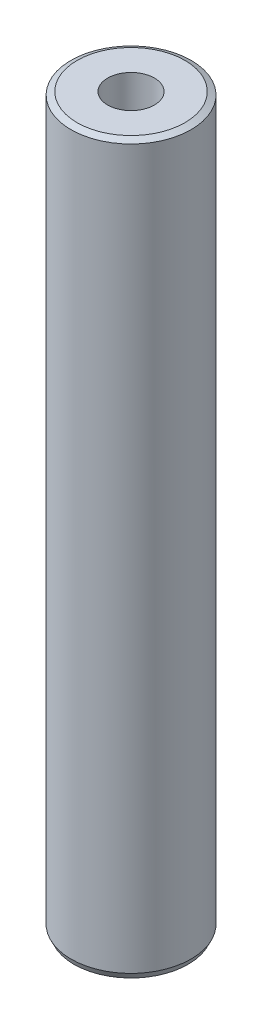
from build123d import *
from OCP.BRepFilletAPI import BRepFilletAPI_MakeChamfer

# Parameters (mm, degrees)
SKETCH1_R           = 10
BOSS_EXTRUDE1_DEPTH = 121.087244038
SKETCH2_R           = 3.893390848
CUT_EXTRUDE1_DEPTH  = 122.910297632
CHAMFER1_SIZE       = 0.498429606
CHAMFER1_SIZE2      = 1.020423305


with BuildPart() as part:
    # Sketch1 → Boss-Extrude1 (new body)
    with BuildSketch(Plane(origin=(0, 0, 0), x_dir=(1, 0, 0), z_dir=(0, 1, 0))):
        Circle(SKETCH1_R)
    extrude(amount=BOSS_EXTRUDE1_DEPTH)

    # Sketch2 → Cut-Extrude1 (cut, through all)
    with BuildSketch(Plane(origin=(0, 0, 0), x_dir=(1, 0, 0), z_dir=(0, 1, 0))):
        Circle(SKETCH2_R)
    extrude(amount=CUT_EXTRUDE1_DEPTH, mode=Mode.SUBTRACT)

    # Chamfer1: one chamfer whose edges measure the first distance from different faces: ONE call of the kernel's chamfer builder (chamfer() names one face for all edges)
    chamfer1_edges_1 = [part.edges().sort_by_distance(p)[0] for p in [
        (-10, 121.087244038, 0),
    ]]
    chamfer1_side_1 = [part.faces().sort_by_distance(p)[0] for p in [
        (-10, 60.543622019, 0),
    ]]
    chamfer1_edges_2 = [part.edges().sort_by_distance(p)[0] for p in [
        (-10, 0, 0),
    ]]
    chamfer1_side_2 = [part.faces().sort_by_distance(p)[0] for p in [
        (-9.717157288, 0, 0),
    ]]
    chamfer1 = BRepFilletAPI_MakeChamfer(part.part.solid().wrapped)
    for e in chamfer1_edges_1:
        chamfer1.Add(CHAMFER1_SIZE, CHAMFER1_SIZE2, e.wrapped, chamfer1_side_1[0].wrapped)  # the first distance lies on this face
    for e in chamfer1_edges_2:
        chamfer1.Add(CHAMFER1_SIZE, CHAMFER1_SIZE2, e.wrapped, chamfer1_side_2[0].wrapped)  # the first distance lies on this face
    add(Compound.cast(chamfer1.Shape()), mode=Mode.REPLACE)


solid = part.part
